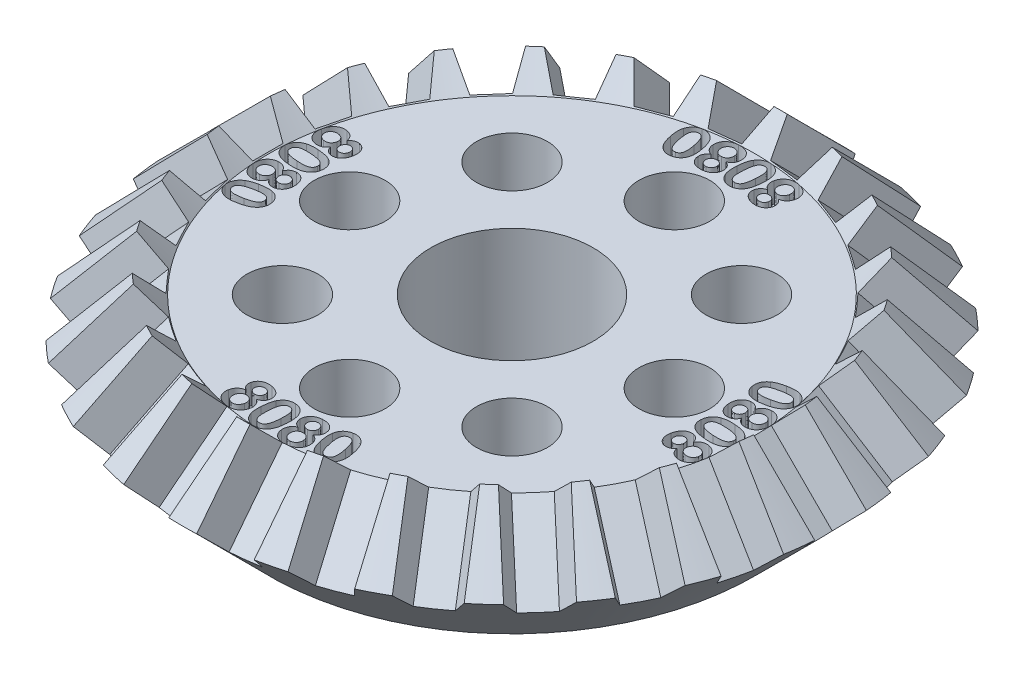
from build123d import *

# Parameters (mm, degrees)
CUT_EXTRUDE3_DEPTH  = 10
SKETCH5_3_R         = 1.75
CUT_EXTRUDE4_DEPTH  = 10
CIRPATTERN3_COUNT   = 8
CUT_EXTRUDE10_DEPTH = 1
CIRPATTERN10_COUNT  = 4
CUT_EXTRUDE11_DEPTH = 10
CIRPATTERN12_COUNT  = 26


with BuildPart() as part:
    # Sketch2 → Revolve4 (revolve)
    with BuildSketch(Plane.XY):
        Polygon((0, 0), (0, 6), (-12, 6), (-13.242640687, 7.242640687), (-16.242640687, 4.242640687), (-12, 0), align=None)
    revolve(axis=Axis((0, 0, 0), (0, 1, 0)))

    # Sketch5 → Cut-Extrude3 (cut)
    with BuildSketch(Plane(origin=(0, 6, 0), x_dir=(1, 0, 0), z_dir=(0, 1, 0))):
        with BuildLine():
            ThreePointArc((4, 0), (-2.828427125, 2.828427125), (0, -4))
            ThreePointArc((0, -4), (2.828427125, -2.828427125), (4, 0))
        make_face()
    extrude(amount=-CUT_EXTRUDE3_DEPTH, mode=Mode.SUBTRACT)

    # Sketch5<3> → Cut-Extrude4 (cut)
    with BuildSketch(Plane(origin=(0, 6, 0), x_dir=(1, 0, 0), z_dir=(0, 1, 0))):
        with Locations((0, -8)):
            Circle(SKETCH5_3_R)
    cut_extrude4 = extrude(amount=-CUT_EXTRUDE4_DEPTH, mode=Mode.SUBTRACT)

    # CirPattern3: Cut-Extrude4 ×8 about axis
    cirpattern3_axis = Axis((0, 0, 0), (0, 1, 0))
    for i in range(1, CIRPATTERN3_COUNT):
        add(cut_extrude4.rotate(cirpattern3_axis, i * 360 / CIRPATTERN3_COUNT), mode=Mode.SUBTRACT)

    # Sketch6 → Cut-Extrude10 (cut)
    # profile 1 of 4: a face of its own
    with BuildSketch(Plane(origin=(0, 6, 0), x_dir=(1, 0, 0), z_dir=(0, 1, 0))):
        with BuildLine():
            add(Edge.make_bspline(
                [(2.856464237, -10.674186552), (2.86301114, -10.70746857), (2.875604707, -10.771489588), (2.889046277, -10.864866803), (2.898886419, -10.951467691), (2.903271988, -11.032326107), (2.902972141, -11.108731392), (2.895780004, -11.182167147), (2.882868034, -11.253378388), (2.869129086, -11.299163516), (2.862323612, -11.321842802)],
                knots=[0, 0, 0, 0, 1.242240845, 2.389564305, 3.454538346, 4.433669945, 5.35421174, 6.250210014, 7.133255941, 8, 8, 8, 8], degree=3))
            add(Edge.make_bspline(
                [(2.862323612, -11.321842802), (2.852227982, -11.350140095), (2.832451329, -11.405572567), (2.791158422, -11.482269275), (2.742074851, -11.5515719), (2.693825223, -11.602241125), (2.652240235, -11.639110293), (2.618865547, -11.663455668), (2.58452233, -11.686017633), (2.548346458, -11.705484239), (2.510782258, -11.722750724), (2.471606508, -11.737529259), (2.430980003, -11.750284603), (2.40300418, -11.75630473), (2.388886112, -11.759342802)],
                knots=[0, 0, 0, 0, 1.594196746, 3.122922871, 4.610547235, 6.093258345, 6.82857878, 7.560442241, 8.28570525, 9.010010991, 9.740500182, 10.480491013, 11.233176019, 12, 12, 12, 12], degree=3))
            add(Edge.make_bspline(
                [(2.388886112, -11.759342802), (2.372518462, -11.762344441), (2.340199736, -11.768271325), (2.291578196, -11.772426929), (2.243638006, -11.772932666), (2.196244232, -11.769259888), (2.149195606, -11.762323253), (2.102660441, -11.751388374), (2.05691574, -11.736351802), (2.011838411, -11.718153686), (1.968449662, -11.695763056), (1.926252796, -11.670723708), (1.885949503, -11.642196874), (1.847835702, -11.610023244), (1.811269161, -11.575205677), (1.776795523, -11.536996136), (1.743896015, -11.495729746), (1.723973038, -11.466127287), (1.713886112, -11.451139677)],
                knots=[0, 0, 0, 0, 1.009576416, 1.993458057, 2.957716521, 3.916680837, 4.875710288, 5.841910214, 6.814168283, 7.796047999, 8.789281496, 9.774685683, 10.772468341, 11.782384999, 12.799758202, 13.834874351, 14.903805263, 16, 16, 16, 16], degree=3))
            add(Edge.make_bspline(
                [(1.713886112, -11.451139677), (1.703876519, -11.434738932), (1.683517323, -11.401380335), (1.657058611, -11.347882221), (1.631297068, -11.291710561), (1.608548415, -11.23181124), (1.587375533, -11.168887907), (1.568431728, -11.102728286), (1.550683419, -11.03374743), (1.540785619, -10.986468446), (1.535761112, -10.962467802)],
                knots=[0, 0, 0, 0, 0.881426141, 1.792792955, 2.736956775, 3.716924484, 4.731750058, 5.783302333, 6.874718359, 8, 8, 8, 8], degree=3))
            add(Edge.make_bspline(
                [(1.535761112, -10.962467802), (1.529833855, -10.931512993), (1.518306003, -10.87130936), (1.504734655, -10.782688321), (1.494016287, -10.698439472), (1.486813052, -10.618317903), (1.483577055, -10.542574345), (1.484294983, -10.471514129), (1.488589948, -10.405045291), (1.495102735, -10.362693712), (1.498261112, -10.342155302)],
                knots=[0, 0, 0, 0, 1.210677909, 2.354632883, 3.443498732, 4.47287823, 5.444113867, 6.354554314, 7.20204066, 8, 8, 8, 8], degree=3))
            add(Edge.make_bspline(
                [(1.498261112, -10.342155302), (1.501668463, -10.32530158), (1.508351972, -10.292243056), (1.52231845, -10.244284278), (1.538510915, -10.198649815), (1.557746695, -10.155435906), (1.579739606, -10.114818001), (1.603892994, -10.076161547), (1.631404628, -10.04024486), (1.661417142, -10.006654332), (1.694094634, -9.975586836), (1.729063356, -9.947195226), (1.766523401, -9.921528423), (1.806444234, -9.898938237), (1.848762772, -9.879005517), (1.893350548, -9.861717406), (1.940461053, -9.84773395), (1.97282539, -9.840409629), (1.989276737, -9.836686552)],
                knots=[0, 0, 0, 0, 1.095393145, 2.14861028, 3.180159673, 4.179429104, 5.159600127, 6.121904536, 7.081198825, 8.039092342, 8.989951051, 9.951575424, 10.906769378, 11.880455666, 12.871560315, 13.885571198, 14.925199563, 16, 16, 16, 16], degree=3))
            add(Edge.make_bspline(
                [(1.989276737, -9.836686552), (2.011093793, -9.83273441), (2.053985867, -9.824964546), (2.118132204, -9.820976658), (2.180250222, -9.822335384), (2.240317655, -9.829800472), (2.298256191, -9.842923971), (2.353741241, -9.862460989), (2.407116435, -9.88687027), (2.457753618, -9.917860863), (2.5062284, -9.953848315), (2.552648516, -9.995258211), (2.596935615, -10.042107862), (2.623684675, -10.076806663), (2.637323612, -10.094499052)],
                knots=[0, 0, 0, 0, 1.07627022, 2.115934445, 3.115636893, 4.090826647, 5.051341732, 5.995514834, 6.94355721, 7.897069916, 8.873694526, 9.87277647, 10.915361214, 12, 12, 12, 12], degree=3))
            add(Edge.make_bspline(
                [(2.637323612, -10.094499052), (2.649082945, -10.111366213), (2.673319802, -10.146130684), (2.70499791, -10.203874704), (2.735546216, -10.267170623), (2.763965726, -10.336708286), (2.789904296, -10.412491239), (2.8146804, -10.494083888), (2.836670476, -10.58205895), (2.849741641, -10.642897063), (2.856464237, -10.674186552)],
                knots=[0, 0, 0, 0, 0.790088108, 1.628430171, 2.528594234, 3.491778536, 4.514595847, 5.607453769, 6.769495871, 8, 8, 8, 8], degree=3))
        make_face()
        with BuildLine():
            add(Edge.make_bspline(
                [(2.501386112, -10.719108427), (2.493741471, -10.68258246), (2.479180136, -10.613008641), (2.45375991, -10.514732641), (2.42708162, -10.427552327), (2.398839506, -10.351080786), (2.367922481, -10.285248563), (2.334760766, -10.228799344), (2.296936295, -10.183058506), (2.262536851, -10.152114927), (2.233486653, -10.132711844), (2.210464484, -10.121834913), (2.186525995, -10.11321938), (2.161461889, -10.106755105), (2.135189467, -10.103789658), (2.107871281, -10.103563114), (2.079342841, -10.105331131), (2.06008501, -10.108758135), (2.050214237, -10.110514677)],
                knots=[0, 0, 0, 0, 2.110143075, 4.01935186, 5.738222495, 7.264530551, 8.624887666, 9.847318779, 10.956058751, 11.96810595, 12.452141123, 12.926387654, 13.40388151, 13.889649879, 14.386509397, 14.894644834, 15.433440349, 16, 16, 16, 16], degree=3))
            add(Edge.make_bspline(
                [(2.050214237, -10.110514677), (2.036285663, -10.11374279), (2.009378681, -10.119978805), (1.972099497, -10.135937865), (1.939318432, -10.156407597), (1.910664997, -10.181330367), (1.886561885, -10.211102015), (1.867072637, -10.245487661), (1.851600554, -10.284210758), (1.841540419, -10.327714117), (1.834463021, -10.375791078), (1.831319358, -10.428954429), (1.830884121, -10.487376078), (1.834303348, -10.55097714), (1.840588964, -10.619771262), (1.850162139, -10.693742965), (1.862489797, -10.772999961), (1.873196111, -10.827346542), (1.878729862, -10.855436552)],
                knots=[0, 0, 0, 0, 0.802607413, 1.550463388, 2.267478245, 2.967856516, 3.675580349, 4.410168812, 5.182317508, 6.011494677, 6.914285185, 7.912074212, 9.002878865, 10.197584679, 11.491336072, 12.886053727, 14.390500749, 16, 16, 16, 16], degree=3))
            add(Edge.make_bspline(
                [(1.878729862, -10.855436552), (1.886661295, -10.892998096), (1.901757356, -10.964489763), (1.927539303, -11.065657266), (1.954547558, -11.155463407), (1.983214606, -11.234247141), (2.014432193, -11.302304928), (2.048514121, -11.360094659), (2.085886679, -11.408008323), (2.120419147, -11.440163421), (2.149842545, -11.460104066), (2.17265578, -11.471896344), (2.196529877, -11.48091573), (2.221332928, -11.487026983), (2.247065961, -11.491300262), (2.27392691, -11.491612324), (2.301838353, -11.490456215), (2.320424848, -11.486924701), (2.329901737, -11.485124052)],
                knots=[0, 0, 0, 0, 2.133037786, 4.059855108, 5.799337743, 7.342271595, 8.714766994, 9.954369444, 11.061747666, 12.08089731, 12.560505073, 13.032964781, 13.504648236, 13.974942341, 14.450769508, 14.950214464, 15.464734931, 16, 16, 16, 16], degree=3))
            add(Edge.make_bspline(
                [(2.329901737, -11.485124052), (2.339721768, -11.482837197), (2.358814218, -11.478391013), (2.38591969, -11.468755115), (2.411277601, -11.457777711), (2.433736242, -11.443264714), (2.455008625, -11.427880376), (2.473179569, -11.409150115), (2.489777607, -11.388912594), (2.508881389, -11.358275337), (2.527923473, -11.314429113), (2.543788357, -11.255345493), (2.552432559, -11.188664373), (2.55375336, -11.128330338), (2.551448386, -11.075986869), (2.548867891, -11.032981773), (2.54431369, -10.987301628), (2.539126452, -10.938785323), (2.531387387, -10.887808594), (2.522897561, -10.83399013), (2.51263933, -10.777512398), (2.50519819, -10.738893036), (2.501386112, -10.719108427)],
                knots=[0, 0, 0, 0, 0.690075242, 1.341668663, 1.968368604, 2.577233658, 3.169474207, 3.762318913, 4.358508892, 4.959814194, 6.229483668, 7.616447763, 9.137695519, 10.824022603, 11.743397326, 12.72649882, 13.774652417, 14.887665546, 16.068312166, 17.305903601, 18.619820697, 20, 20, 20, 20], degree=3))
        make_face(mode=Mode.SUBTRACT)
    # profile 2 of 4: a face of its own
    with BuildSketch(Plane(origin=(0, 6, 0), x_dir=(1, 0, 0), z_dir=(0, 1, 0))):
        with BuildLine():
            add(Edge.make_bspline(
                [(0.091015625, -10.5375), (0.090562136, -10.515995585), (0.089656226, -10.473037365), (0.098779814, -10.408955566), (0.117824615, -10.346521753), (0.144389199, -10.285616397), (0.18051955, -10.228072083), (0.225453106, -10.17509243), (0.279745939, -10.128272988), (0.341527469, -10.086289189), (0.411058414, -10.051242218), (0.487420864, -10.024271245), (0.570200558, -10.0056964), (0.627773305, -10.000389285), (0.657421875, -9.99765625)],
                knots=[0, 0, 0, 0, 0.885377428, 1.768671152, 2.653186392, 3.568480428, 4.498998694, 5.443018017, 6.420261347, 7.444178353, 8.514441937, 9.619293894, 10.773994056, 12, 12, 12, 12], degree=3))
            add(Edge.make_bspline(
                [(0.657421875, -9.99765625), (0.682417276, -9.996481536), (0.731117542, -9.994192759), (0.802069996, -9.997383133), (0.868770722, -10.00580227), (0.930926731, -10.020008798), (0.988906351, -10.038414183), (1.041919663, -10.062257448), (1.090776363, -10.089374996), (1.13445324, -10.121269913), (1.173844942, -10.156079256), (1.208175656, -10.1940219), (1.238000816, -10.234542219), (1.262016963, -10.278070511), (1.281594404, -10.323660296), (1.297002697, -10.370919428), (1.307175895, -10.42008646), (1.310455569, -10.453475682), (1.312109375, -10.4703125)],
                knots=[0, 0, 0, 0, 1.323619717, 2.578899647, 3.753217694, 4.876536483, 5.948622175, 6.966573872, 7.947736925, 8.90014609, 9.822571302, 10.725014941, 11.602950856, 12.479019021, 13.349405345, 14.225392214, 15.105137946, 16, 16, 16, 16], degree=3))
            add(Edge.make_bspline(
                [(1.312109375, -10.4703125), (1.312655067, -10.491678673), (1.31372408, -10.533535113), (1.306009466, -10.595266016), (1.288707399, -10.65362361), (1.26407168, -10.709104971), (1.231207918, -10.761248568), (1.188728291, -10.808126629), (1.139556802, -10.852363182), (1.101319548, -10.876334804), (1.081640625, -10.888671875)],
                knots=[0, 0, 0, 0, 1.015178715, 1.988740217, 2.942761119, 3.898728001, 4.867238565, 5.858352967, 6.8977946, 8, 8, 8, 8], degree=3))
            add(Edge.make_bspline(
                [(1.081640625, -10.888671875), (1.09958388, -10.895036435), (1.134604388, -10.90745838), (1.184287317, -10.93033866), (1.228856022, -10.958015778), (1.269498985, -10.98863175), (1.305981306, -11.022510439), (1.337588724, -11.060075832), (1.365901592, -11.099960917), (1.388627223, -11.143713681), (1.407962302, -11.189900589), (1.42288906, -11.239071492), (1.433020362, -11.29106263), (1.43625043, -11.326783287), (1.437890625, -11.344921875)],
                knots=[0, 0, 0, 0, 1.107312827, 2.161182956, 3.174501651, 4.153169377, 5.117812601, 6.063473442, 7.004847067, 7.957038124, 8.924858285, 9.914486592, 10.940997423, 12, 12, 12, 12], degree=3))
            add(Edge.make_bspline(
                [(1.437890625, -11.344921875), (1.438757936, -11.3717665), (1.440465484, -11.424617794), (1.430288812, -11.502604725), (1.410197676, -11.577357743), (1.38507078, -11.636640028), (1.360277758, -11.681763712), (1.339071032, -11.714098933), (1.315096424, -11.744375629), (1.289287485, -11.773616715), (1.260622246, -11.800986191), (1.229471027, -11.82659218), (1.195975639, -11.850670219), (1.160156078, -11.872743727), (1.122280387, -11.89314307), (1.082329059, -11.911131256), (1.040363486, -11.926660466), (0.99672225, -11.94036811), (0.951200906, -11.951714847), (0.903856092, -11.960672337), (0.854677946, -11.967257525), (0.821238109, -11.970063046), (0.804296875, -11.971484375)],
                knots=[0, 0, 0, 0, 1.605423181, 3.160732928, 4.686335019, 6.226418963, 7.000776911, 7.765942991, 8.537629648, 9.310378071, 10.098573263, 10.906817449, 11.722169023, 12.565603334, 13.423318424, 14.29532419, 15.185561533, 16.100029279, 17.031865636, 17.991730252, 18.982573711, 20, 20, 20, 20], degree=3))
            add(Edge.make_bspline(
                [(0.804296875, -11.971484375), (0.786594227, -11.972420129), (0.751856334, -11.974256359), (0.70061143, -11.97433207), (0.65120139, -11.971530773), (0.603489274, -11.966446666), (0.557496285, -11.959291493), (0.513479786, -11.948879961), (0.471104895, -11.936550364), (0.430756134, -11.921250984), (0.392168272, -11.904100178), (0.356095068, -11.884623279), (0.322149415, -11.863373508), (0.290447374, -11.840254769), (0.260670622, -11.815340285), (0.233411064, -11.788284339), (0.208023336, -11.759674594), (0.178227818, -11.718488334), (0.145398473, -11.663722557), (0.116883797, -11.592271009), (0.096046519, -11.516675321), (0.090899345, -11.464194313), (0.08828125, -11.4375)],
                knots=[0, 0, 0, 0, 1.056687181, 2.073536468, 3.05308287, 4.005433391, 4.93317154, 5.825656735, 6.699999817, 7.562164195, 8.396014702, 9.215617158, 10.003854028, 10.781703213, 11.552940231, 12.315890682, 13.069464797, 13.830200813, 15.343831432, 16.861675642, 18.4037004, 20, 20, 20, 20], degree=3))
            add(Edge.make_bspline(
                [(0.08828125, -11.4375), (0.087555319, -11.423180123), (0.086130037, -11.395064685), (0.087525137, -11.353576218), (0.090877492, -11.313498465), (0.097057228, -11.274953546), (0.1060935, -11.23799446), (0.117773213, -11.202680405), (0.132478021, -11.169004482), (0.149019554, -11.136509417), (0.168769129, -11.105857895), (0.191262508, -11.076861345), (0.216066984, -11.049021094), (0.244207338, -11.023399415), (0.274090561, -10.998486872), (0.307343295, -10.976024338), (0.342670001, -10.954245779), (0.367985715, -10.941850286), (0.380859375, -10.935546875)],
                knots=[0, 0, 0, 0, 1.104846412, 2.169239406, 3.197034392, 4.20363341, 5.174984358, 6.127218024, 7.066937521, 8.00520853, 8.935174661, 9.872747451, 10.832201301, 11.805210376, 12.803820586, 13.828424798, 14.895700858, 16, 16, 16, 16], degree=3))
            add(Edge.make_bspline(
                [(0.380859375, -10.935546875), (0.359337954, -10.925687558), (0.317533137, -10.906536085), (0.261328666, -10.869307169), (0.21263401, -10.827341969), (0.171815778, -10.779907492), (0.138884953, -10.727016257), (0.114946534, -10.668408257), (0.097466067, -10.604937978), (0.093206068, -10.560400614), (0.091015625, -10.5375)],
                knots=[0, 0, 0, 0, 1.088100052, 2.113606884, 3.090567581, 4.038252801, 4.98282562, 5.944410651, 6.943038984, 8, 8, 8, 8], degree=3))
        make_face()
        with BuildLine():
            add(Edge.make_bspline(
                [(1.087109375, -11.3578125), (1.08555354, -11.341477375), (1.082523004, -11.309658975), (1.071470032, -11.264078273), (1.055303666, -11.222052565), (1.034247545, -11.183829108), (1.008801033, -11.149458129), (0.978787324, -11.119955254), (0.944772794, -11.094975833), (0.906886111, -11.075208338), (0.866069122, -11.06056772), (0.823314159, -11.050010476), (0.778325416, -11.045954335), (0.747917272, -11.04682298), (0.732421875, -11.047265625)],
                knots=[0, 0, 0, 0, 1.111946973, 2.165907724, 3.169714848, 4.157975736, 5.117155495, 6.060218951, 7.001792314, 7.96971562, 8.947661179, 9.93738128, 10.948929762, 12, 12, 12, 12], degree=3))
            add(Edge.make_bspline(
                [(0.732421875, -11.047265625), (0.72145822, -11.048237744), (0.699779517, -11.050159939), (0.668248609, -11.0564526), (0.638257115, -11.065418811), (0.610030053, -11.077404709), (0.582794581, -11.091269642), (0.557551016, -11.108568533), (0.533837121, -11.128406647), (0.511658498, -11.150447348), (0.491730105, -11.17496227), (0.47479417, -11.201703071), (0.461151067, -11.2305047), (0.450102664, -11.26107021), (0.442250479, -11.293822213), (0.437848706, -11.328517351), (0.435640044, -11.365223851), (0.436867431, -11.390234851), (0.4375, -11.403125)],
                knots=[0, 0, 0, 0, 1.014644763, 2.006281978, 2.959953283, 3.896761675, 4.831489039, 5.774206984, 6.712246399, 7.68040392, 8.653910418, 9.620203729, 10.592524108, 11.587863777, 12.613256297, 13.69185118, 14.810428164, 16, 16, 16, 16], degree=3))
            add(Edge.make_bspline(
                [(0.4375, -11.403125), (0.43900521, -11.419603222), (0.441940312, -11.451735133), (0.453740639, -11.49766455), (0.469584479, -11.54054002), (0.491172075, -11.57943293), (0.516923142, -11.614520237), (0.54701326, -11.644579415), (0.579904248, -11.671023296), (0.616990342, -11.691365473), (0.656182232, -11.70772386), (0.697878976, -11.717485155), (0.74097502, -11.723607454), (0.770293719, -11.722457796), (0.78515625, -11.721875)],
                knots=[0, 0, 0, 0, 1.125511206, 2.194704449, 3.219371301, 4.231678358, 5.214488266, 6.174129957, 7.121684634, 8.078863597, 9.04573379, 10.005211496, 10.988781613, 12, 12, 12, 12], degree=3))
            add(Edge.make_bspline(
                [(0.78515625, -11.721875), (0.800196842, -11.720318065), (0.829706935, -11.717263312), (0.872332692, -11.705946757), (0.912393755, -11.690107287), (0.949298554, -11.668684333), (0.983040391, -11.643194886), (1.012084578, -11.612526592), (1.037419765, -11.578304021), (1.05814316, -11.539933101), (1.073553032, -11.498052502), (1.084363195, -11.453531919), (1.08901931, -11.406333181), (1.087755276, -11.374221195), (1.087109375, -11.3578125)],
                knots=[0, 0, 0, 0, 1.025163234, 2.011401093, 2.983152565, 3.941422299, 4.899692033, 5.843708402, 6.798424513, 7.783274895, 8.793040319, 9.820031211, 10.886071978, 12, 12, 12, 12], degree=3))
        make_face(mode=Mode.SUBTRACT)
        with BuildLine():
            add(Edge.make_bspline(
                [(0.681640625, -10.247265625), (0.671581345, -10.248077851), (0.651838222, -10.249671987), (0.623325889, -10.255925035), (0.596069651, -10.263409296), (0.570833858, -10.2741613), (0.546927641, -10.286611568), (0.525080795, -10.302059539), (0.50463071, -10.319575484), (0.480396029, -10.346219974), (0.454455658, -10.383292941), (0.434273328, -10.434089976), (0.422611536, -10.48957661), (0.423669588, -10.528068424), (0.42421875, -10.548046875)],
                knots=[0, 0, 0, 0, 0.815821317, 1.601194102, 2.358270731, 3.100009384, 3.816617665, 4.535778502, 5.260477344, 5.991356284, 7.447023481, 8.893237821, 10.387493616, 12, 12, 12, 12], degree=3))
            add(Edge.make_bspline(
                [(0.42421875, -10.548046875), (0.426380318, -10.566416668), (0.430582601, -10.602129204), (0.448591702, -10.652602827), (0.476617671, -10.697197138), (0.513450838, -10.735454225), (0.557621106, -10.766093195), (0.607797544, -10.78694358), (0.662898017, -10.798425541), (0.700990886, -10.797403753), (0.720703125, -10.796875)],
                knots=[0, 0, 0, 0, 1.022121576, 1.987096651, 2.939674523, 3.91906958, 4.909371642, 5.895251516, 6.910837982, 8, 8, 8, 8], degree=3))
            add(Edge.make_bspline(
                [(0.720703125, -10.796875), (0.730894579, -10.796074171), (0.750772649, -10.794512181), (0.779520214, -10.788149538), (0.806943961, -10.780798482), (0.840514888, -10.766536383), (0.878728798, -10.744042068), (0.917208498, -10.708697836), (0.947539621, -10.666668307), (0.964598301, -10.626598135), (0.973910386, -10.592342699), (0.978700087, -10.565288235), (0.980133897, -10.536982107), (0.979322708, -10.517965891), (0.97890625, -10.508203125)],
                knots=[0, 0, 0, 0, 0.845290105, 1.648708541, 2.433540701, 3.192322416, 4.66215161, 6.08133375, 7.487434833, 8.921403278, 9.658902866, 10.424546004, 11.191175161, 12, 12, 12, 12], degree=3))
            add(Edge.make_bspline(
                [(0.97890625, -10.508203125), (0.977675267, -10.49526083), (0.975261724, -10.469885335), (0.966045446, -10.433267915), (0.952785196, -10.398932384), (0.935003088, -10.367342378), (0.914153806, -10.338253382), (0.889136439, -10.312968549), (0.860775461, -10.291458694), (0.82951647, -10.273311584), (0.795483557, -10.259887386), (0.759384919, -10.250098306), (0.721051764, -10.245926324), (0.69492481, -10.246814191), (0.681640625, -10.247265625)],
                knots=[0, 0, 0, 0, 1.05491296, 2.068330136, 3.056421155, 4.036609821, 5.005661574, 5.955645856, 6.914073567, 7.890258411, 8.882248801, 9.877786146, 10.920965635, 12, 12, 12, 12], degree=3))
        make_face(mode=Mode.SUBTRACT)
    # profile 3 of 4: a face of its own
    with BuildSketch(Plane(origin=(0, 6, 0), x_dir=(1, 0, 0), z_dir=(0, 1, 0))):
        with BuildLine():
            add(Edge.make_bspline(
                [(-0.055292362, -11.039811552), (-0.057715214, -11.074215899), (-0.062376945, -11.140412177), (-0.074127747, -11.235717947), (-0.087261139, -11.323419739), (-0.104055175, -11.404102917), (-0.12495582, -11.478921102), (-0.150098924, -11.549408974), (-0.180926343, -11.615894291), (-0.205828108, -11.657205725), (-0.218182987, -11.677702177)],
                knots=[0, 0, 0, 0, 1.24359613, 2.392762546, 3.462014738, 4.440998777, 5.362732067, 6.261390359, 7.137397951, 8, 8, 8, 8], degree=3))
            add(Edge.make_bspline(
                [(-0.218182987, -11.677702177), (-0.235428484, -11.702005731), (-0.269268118, -11.749694901), (-0.329437501, -11.81209352), (-0.395007172, -11.865565914), (-0.454890392, -11.901517911), (-0.505180762, -11.924949114), (-0.543561466, -11.940290797), (-0.583095794, -11.952308385), (-0.62306432, -11.962231596), (-0.664100893, -11.968857146), (-0.705865603, -11.972544228), (-0.748527736, -11.974500435), (-0.777169558, -11.972993656), (-0.791620487, -11.972233427)],
                knots=[0, 0, 0, 0, 1.582984985, 3.106180934, 4.593200904, 6.071731909, 6.805912463, 7.542733435, 8.267712544, 9.001664467, 9.731390239, 10.475560986, 11.230860376, 12, 12, 12, 12], degree=3))
            add(Edge.make_bspline(
                [(-0.791620487, -11.972233427), (-0.808189227, -11.970797375), (-0.841102552, -11.9679447), (-0.8894082, -11.95919709), (-0.936293365, -11.947279565), (-0.981157941, -11.930741873), (-1.025189505, -11.91249818), (-1.067107917, -11.889326932), (-1.107777252, -11.863373897), (-1.146421788, -11.833513594), (-1.182946762, -11.800855204), (-1.217196529, -11.765615182), (-1.248337943, -11.727490152), (-1.277478921, -11.687239403), (-1.30366657, -11.644103113), (-1.327019404, -11.598354223), (-1.347904428, -11.550068256), (-1.359539242, -11.516583978), (-1.365448612, -11.499577177)],
                knots=[0, 0, 0, 0, 1.007705959, 2.001778921, 2.972448205, 3.93616012, 4.897995282, 5.858696146, 6.835221081, 7.820385187, 8.815460491, 9.803529574, 10.796002961, 11.797102365, 12.813764792, 13.85165546, 14.908847002, 16, 16, 16, 16], degree=3))
            add(Edge.make_bspline(
                [(-1.365448612, -11.499577177), (-1.37044765, -11.480741356), (-1.38062888, -11.442379609), (-1.39270535, -11.38307925), (-1.401596851, -11.3209822), (-1.407814234, -11.256195727), (-1.411174131, -11.188677793), (-1.41228386, -11.118720725), (-1.411294018, -11.046268651), (-1.408353381, -10.997225367), (-1.406854862, -10.972233427)],
                knots=[0, 0, 0, 0, 0.879784648, 1.791802786, 2.730490244, 3.710942958, 4.729401934, 5.781907883, 6.869683615, 8, 8, 8, 8], degree=3))
            add(Edge.make_bspline(
                [(-1.406854862, -10.972233427), (-1.404418437, -10.94018787), (-1.399678543, -10.877845491), (-1.389959633, -10.786894145), (-1.377824612, -10.701196205), (-1.364037123, -10.6204406), (-1.34731653, -10.545221747), (-1.328186114, -10.475605873), (-1.307180658, -10.411546315), (-1.289835231, -10.371856626), (-1.281464237, -10.352702177)],
                knots=[0, 0, 0, 0, 1.214105754, 2.361957455, 3.454863437, 4.483567602, 5.456243376, 6.364424514, 7.210662786, 8, 8, 8, 8], degree=3))
            add(Edge.make_bspline(
                [(-1.281464237, -10.352702177), (-1.273707919, -10.33749671), (-1.258410498, -10.307507684), (-1.232592783, -10.264941934), (-1.20482249, -10.225383487), (-1.175143772, -10.188740996), (-1.14286923, -10.155720968), (-1.109330273, -10.124840366), (-1.073249937, -10.097575135), (-1.035273016, -10.073216908), (-0.995450772, -10.052280557), (-0.954137985, -10.034072897), (-0.911178322, -10.019235064), (-0.866615842, -10.007888775), (-0.820458268, -10.000254448), (-0.772874414, -9.995019987), (-0.723500952, -9.993397603), (-0.690182566, -9.995164298), (-0.673261112, -9.996061552)],
                knots=[0, 0, 0, 0, 1.087313565, 2.144457309, 3.16869824, 4.165110493, 5.1449449, 6.108166238, 7.067234196, 8.022310891, 8.979798717, 9.930831212, 10.896336421, 11.872229232, 12.856968448, 13.874839303, 14.920691774, 16, 16, 16, 16], degree=3))
            add(Edge.make_bspline(
                [(-0.673261112, -9.996061552), (-0.651072506, -9.998137688), (-0.607718712, -10.002194202), (-0.544663989, -10.014899269), (-0.485250407, -10.032749929), (-0.429282868, -10.056021367), (-0.376921013, -10.084116183), (-0.328067784, -10.117044893), (-0.283269456, -10.155304974), (-0.242190293, -10.198486908), (-0.204596304, -10.246400447), (-0.170427876, -10.298979913), (-0.140294595, -10.356621627), (-0.123584995, -10.397477953), (-0.115057987, -10.418327177)],
                knots=[0, 0, 0, 0, 1.077911837, 2.10610642, 3.106823242, 4.075788751, 5.034351033, 5.978135135, 6.921351078, 7.879602627, 8.857846599, 9.864596358, 10.910290938, 12, 12, 12, 12], degree=3))
            add(Edge.make_bspline(
                [(-0.115057987, -10.418327177), (-0.108059929, -10.437748815), (-0.093594969, -10.477893264), (-0.07824768, -10.542411415), (-0.065245428, -10.611995445), (-0.05590515, -10.687130217), (-0.05084567, -10.767733043), (-0.048297513, -10.853602297), (-0.050146899, -10.944947157), (-0.053541345, -11.0075289), (-0.055292362, -11.039811552)],
                knots=[0, 0, 0, 0, 0.787298717, 1.627343327, 2.526948887, 3.488476923, 4.514511237, 5.608160759, 6.766175108, 8, 8, 8, 8], degree=3))
        make_face()
        with BuildLine():
            add(Edge.make_bspline(
                [(-0.403729862, -10.990202177), (-0.402484595, -10.970805267), (-0.400053665, -10.932939877), (-0.39771866, -10.877328546), (-0.396532287, -10.824324228), (-0.396440116, -10.773916617), (-0.397789882, -10.7262608), (-0.39936657, -10.681286078), (-0.403199146, -10.638991226), (-0.408417105, -10.587181261), (-0.418823057, -10.528076317), (-0.436763963, -10.463814604), (-0.4612697, -10.408719666), (-0.486948798, -10.369163627), (-0.510703604, -10.342752306), (-0.52997786, -10.325321365), (-0.551243116, -10.310399297), (-0.574454655, -10.297856214), (-0.599611966, -10.287641576), (-0.62677286, -10.280031435), (-0.655576291, -10.273873723), (-0.675573727, -10.272269449), (-0.685761112, -10.271452177)],
                knots=[0, 0, 0, 0, 1.347224129, 2.629963582, 3.857706145, 5.02197285, 6.123395143, 7.162287872, 8.140401428, 9.066322185, 10.771248516, 12.29364159, 13.679227141, 14.935823134, 15.542939666, 16.137310484, 16.733255253, 17.339028606, 17.962494908, 18.610875038, 19.292331773, 20, 20, 20, 20], degree=3))
            add(Edge.make_bspline(
                [(-0.685761112, -10.271452177), (-0.70036023, -10.271029705), (-0.728508777, -10.270215139), (-0.769434689, -10.275916936), (-0.807397431, -10.286680176), (-0.842303215, -10.303750941), (-0.873868475, -10.326771077), (-0.902167681, -10.355447697), (-0.927896488, -10.389254191), (-0.94944676, -10.429366235), (-0.968985928, -10.474815948), (-0.986919834, -10.526097933), (-1.00264814, -10.583443448), (-1.01676459, -10.646661861), (-1.028613077, -10.715929895), (-1.039190512, -10.791208352), (-1.047652225, -10.872527231), (-1.051916573, -10.928732245), (-1.054120487, -10.957780302)],
                knots=[0, 0, 0, 0, 0.804633657, 1.55141345, 2.269836358, 2.973487496, 3.683382399, 4.414904861, 5.189370088, 6.019047464, 6.919945208, 7.91741533, 9.013804953, 10.199028576, 11.489992763, 12.890051375, 14.392706351, 16, 16, 16, 16], degree=3))
            add(Edge.make_bspline(
                [(-1.054120487, -10.957780302), (-1.055383266, -10.97769777), (-1.057858218, -11.016734513), (-1.059946377, -11.073916756), (-1.061906746, -11.128340909), (-1.06155586, -11.180047433), (-1.061176712, -11.229164537), (-1.058569228, -11.275515167), (-1.05559671, -11.319167735), (-1.05013837, -11.372376124), (-1.039841215, -11.433177116), (-1.021801596, -11.499137897), (-0.997841575, -11.556097837), (-0.972134439, -11.596658269), (-0.948720778, -11.624084088), (-0.929436655, -11.641782116), (-0.908264111, -11.657015286), (-0.885465115, -11.669929992), (-0.861082807, -11.680755164), (-0.834706501, -11.68817686), (-0.806850984, -11.694473896), (-0.787489213, -11.69603967), (-0.777557987, -11.696842802)],
                knots=[0, 0, 0, 0, 1.359986968, 2.665472411, 3.899394637, 5.07069201, 6.188889434, 7.246173117, 8.233682529, 9.170495203, 10.890437338, 12.429874823, 13.821057553, 15.086234431, 15.683926685, 16.274262244, 16.865330931, 17.457464368, 18.057523209, 18.677968164, 19.32189076, 20, 20, 20, 20], degree=3))
            add(Edge.make_bspline(
                [(-0.777557987, -11.696842802), (-0.767270845, -11.697304455), (-0.747198884, -11.69820522), (-0.717893141, -11.696163879), (-0.690040491, -11.691658769), (-0.664068636, -11.683502622), (-0.639008292, -11.674046169), (-0.615920257, -11.660885679), (-0.594256435, -11.645207207), (-0.567324965, -11.620086654), (-0.536526562, -11.582207787), (-0.505569021, -11.528060825), (-0.479035656, -11.464931347), (-0.461522316, -11.406056153), (-0.449365614, -11.354159772), (-0.440973029, -11.311238172), (-0.432604522, -11.26531669), (-0.425202315, -11.216349629), (-0.419125958, -11.164069278), (-0.41334757, -11.108851293), (-0.407605758, -11.050554453), (-0.405043328, -11.01065438), (-0.403729862, -10.990202177)],
                knots=[0, 0, 0, 0, 0.691779302, 1.349778805, 1.971490277, 2.583574748, 3.176905472, 3.768684325, 4.364013561, 4.97113264, 6.239934178, 7.628716957, 9.150586104, 10.834249415, 11.751530657, 12.733528869, 13.774101558, 14.889562165, 16.062224763, 17.312193944, 18.62226927, 20, 20, 20, 20], degree=3))
        make_face(mode=Mode.SUBTRACT)
    # profile 4 of 4: a face of its own
    with BuildSketch(Plane(origin=(0, 6, 0), x_dir=(1, 0, 0), z_dir=(0, 1, 0))):
        with BuildLine():
            add(Edge.make_bspline(
                [(-2.685152226, -10.189414569), (-2.680155506, -10.16916745), (-2.670205648, -10.128849802), (-2.644471239, -10.071712078), (-2.61095781, -10.018100753), (-2.56940304, -9.968457802), (-2.520316633, -9.923596667), (-2.462921783, -9.88653285), (-2.39895481, -9.856250095), (-2.328515412, -9.833352927), (-2.252594729, -9.818364079), (-2.172040964, -9.81386452), (-2.087722939, -9.817291808), (-2.031031481, -9.827524588), (-2.001949101, -9.832773944)],
                knots=[0, 0, 0, 0, 0.871624012, 1.73564591, 2.609925243, 3.511712334, 4.437997528, 5.382990385, 6.360794964, 7.393410267, 8.476424962, 9.590761808, 10.764075129, 12, 12, 12, 12], degree=3))
            add(Edge.make_bspline(
                [(-2.001949101, -9.832773944), (-1.97750721, -9.83813577), (-1.930128464, -9.848529262), (-1.862540807, -9.869731856), (-1.800579868, -9.895073067), (-1.744210843, -9.924437066), (-1.693261913, -9.956896517), (-1.647660518, -9.991970604), (-1.60788285, -10.03012003), (-1.573778353, -10.070803438), (-1.545365646, -10.1135754), (-1.521383427, -10.157378861), (-1.504035159, -10.202978106), (-1.491303053, -10.249403457), (-1.483912708, -10.29658594), (-1.48172137, -10.344349939), (-1.483725198, -10.392575498), (-1.489346706, -10.424484347), (-1.492183476, -10.440586444)],
                knots=[0, 0, 0, 0, 1.348453565, 2.613874664, 3.813106085, 4.952763529, 6.035397086, 7.065967044, 8.048918765, 9.000673855, 9.921513113, 10.813377793, 11.686736987, 12.544929923, 13.404671582, 14.255049625, 15.119449307, 16, 16, 16, 16], degree=3))
            add(Edge.make_bspline(
                [(-1.492183476, -10.440586444), (-1.496898671, -10.46057757), (-1.506187685, -10.499960417), (-1.530713765, -10.554893296), (-1.561626488, -10.605411679), (-1.600841327, -10.64991386), (-1.646459898, -10.689707725), (-1.699941087, -10.722243051), (-1.759921782, -10.749780834), (-1.803307682, -10.762252416), (-1.825777226, -10.768711444)],
                knots=[0, 0, 0, 0, 0.992402003, 1.955048323, 2.897862626, 3.849632644, 4.815061215, 5.817344054, 6.869603164, 8, 8, 8, 8], degree=3))
            add(Edge.make_bspline(
                [(-1.825777226, -10.768711444), (-1.809815642, -10.779631053), (-1.778599486, -10.800986594), (-1.736186156, -10.83707912), (-1.699210646, -10.875815167), (-1.667959559, -10.917226322), (-1.640984935, -10.960125122), (-1.620078065, -11.005447174), (-1.603222761, -11.05228248), (-1.592232738, -11.101237881), (-1.585247409, -11.151696238), (-1.584548681, -11.203782384), (-1.587612499, -11.257467833), (-1.594261599, -11.29337154), (-1.597652226, -11.311680194)],
                knots=[0, 0, 0, 0, 1.105053412, 2.161159013, 3.177396091, 4.160033802, 5.122703083, 6.06844416, 7.007835938, 7.963050841, 8.931630876, 9.914494131, 10.936521936, 12, 12, 12, 12], degree=3))
            add(Edge.make_bspline(
                [(-1.597652226, -11.311680194), (-1.603774193, -11.338353874), (-1.615797178, -11.390738544), (-1.647055967, -11.464424744), (-1.68537693, -11.533126039), (-1.725829693, -11.584500937), (-1.761800593, -11.62230572), (-1.791052608, -11.648276835), (-1.822013649, -11.672315456), (-1.854955709, -11.69381888), (-1.889807407, -11.713048358), (-1.926639643, -11.729647058), (-1.96510678, -11.744802415), (-2.005653616, -11.757031931), (-2.047576394, -11.767381628), (-2.090986771, -11.774194442), (-2.135304801, -11.778985902), (-2.180969722, -11.780890567), (-2.227791809, -11.780077625), (-2.275776224, -11.77652048), (-2.324942312, -11.770281329), (-2.357837105, -11.764066816), (-2.374605351, -11.760898944)],
                knots=[0, 0, 0, 0, 1.622906997, 3.187241106, 4.735794135, 6.284656248, 7.056058448, 7.833987435, 8.606048672, 9.382707507, 10.168595054, 10.968182088, 11.781237813, 12.622932006, 13.482214688, 14.344417036, 15.231115921, 16.129246605, 17.057614334, 18.011602718, 18.986406943, 20, 20, 20, 20], degree=3))
            add(Edge.make_bspline(
                [(-2.374605351, -11.760898944), (-2.391830676, -11.757151672), (-2.425819207, -11.74975766), (-2.47525268, -11.736125783), (-2.522318455, -11.720467837), (-2.566940382, -11.702910276), (-2.609201328, -11.683353116), (-2.649103007, -11.662004472), (-2.686396329, -11.638273742), (-2.721595177, -11.613129166), (-2.753890401, -11.58571769), (-2.783659761, -11.557052934), (-2.811136789, -11.52758427), (-2.835472398, -11.496336342), (-2.85741026, -11.464043835), (-2.876469436, -11.430223088), (-2.893618003, -11.395479944), (-2.911447005, -11.347080888), (-2.927941364, -11.284536914), (-2.937291376, -11.207029343), (-2.936331494, -11.12734907), (-2.927522399, -11.07449482), (-2.923042851, -11.047617694)],
                knots=[0, 0, 0, 0, 1.042727639, 2.057481098, 3.031843988, 3.975926965, 4.892682842, 5.78533566, 6.650854324, 7.506027771, 8.342399275, 9.154145028, 9.950056979, 10.723625334, 11.49488911, 12.257331962, 13.018723465, 13.784156682, 15.305009657, 16.833723396, 18.389904019, 20, 20, 20, 20], degree=3))
            add(Edge.make_bspline(
                [(-2.923042851, -11.047617694), (-2.919974338, -11.033379422), (-2.913928092, -11.005324098), (-2.901799229, -10.964714692), (-2.88727532, -10.926413745), (-2.870967985, -10.890250969), (-2.852056035, -10.856469429), (-2.831008133, -10.824878902), (-2.807916967, -10.795462889), (-2.782698717, -10.768294646), (-2.755363534, -10.743213129), (-2.725537394, -10.720496235), (-2.693464473, -10.700203693), (-2.65926757, -10.682302538), (-2.623136971, -10.665998565), (-2.584521225, -10.652555067), (-2.543785507, -10.641180337), (-2.515788996, -10.635347916), (-2.501558476, -10.632383319)],
                knots=[0, 0, 0, 0, 1.102536161, 2.172455328, 3.205207983, 4.202285652, 5.17328625, 6.133060449, 7.073860762, 8.001709011, 8.93680965, 9.879364708, 10.836654476, 11.80690401, 12.799927807, 13.835171574, 14.899625893, 16, 16, 16, 16], degree=3))
            add(Edge.make_bspline(
                [(-2.501558476, -10.632383319), (-2.520161276, -10.617571892), (-2.556072593, -10.588979537), (-2.602334174, -10.540405161), (-2.639734862, -10.488971578), (-2.667236103, -10.434120406), (-2.686009081, -10.376712991), (-2.69525288, -10.316487597), (-2.695955712, -10.253351038), (-2.688815489, -10.211094246), (-2.685152226, -10.189414569)],
                knots=[0, 0, 0, 0, 1.119369536, 2.160859352, 3.15006076, 4.104875564, 5.040033796, 5.984125014, 6.965763493, 8, 8, 8, 8], degree=3))
        make_face()
        with BuildLine():
            add(Edge.make_bspline(
                [(-1.945308476, -11.230820819), (-1.942433559, -11.214333404), (-1.936848217, -11.182301918), (-1.935319024, -11.134625329), (-1.939654682, -11.089237205), (-1.949228242, -11.046199049), (-1.964642193, -11.006007784), (-1.984961722, -10.969156531), (-2.010300002, -10.935647541), (-2.040993203, -10.906647359), (-2.075341166, -10.88103918), (-2.113551439, -10.860367415), (-2.15490873, -10.844116536), (-2.184008504, -10.837118242), (-2.198824101, -10.833555194)],
                knots=[0, 0, 0, 0, 1.134878421, 2.20482367, 3.225797407, 4.222734846, 5.18782571, 6.137209725, 7.070497099, 8.026807576, 8.993677261, 9.970552431, 10.966745317, 12, 12, 12, 12], degree=3))
            add(Edge.make_bspline(
                [(-2.198824101, -10.833555194), (-2.209472926, -10.831647008), (-2.230402723, -10.827896554), (-2.261828475, -10.826043768), (-2.29246272, -10.827110867), (-2.322260985, -10.831560264), (-2.351381564, -10.83848197), (-2.37974848, -10.84883648), (-2.407334346, -10.862077334), (-2.434103908, -10.878174952), (-2.459221535, -10.897032537), (-2.482304107, -10.918908076), (-2.502835743, -10.943524977), (-2.521505882, -10.970745926), (-2.537416951, -11.000963259), (-2.550976702, -11.033826577), (-2.562553209, -11.069315145), (-2.56792777, -11.094174335), (-2.570699101, -11.106992694)],
                knots=[0, 0, 0, 0, 0.999188164, 1.963860241, 2.903277925, 3.827462478, 4.74401454, 5.66529519, 6.612696302, 7.568317307, 8.547962603, 9.509928301, 10.500746384, 11.505499891, 12.555369756, 13.65054731, 14.788531397, 16, 16, 16, 16], degree=3))
            add(Edge.make_bspline(
                [(-2.570699101, -11.106992694), (-2.573593043, -11.123482593), (-2.579260395, -11.155775592), (-2.580485689, -11.203933466), (-2.577032472, -11.25022131), (-2.566538174, -11.293977866), (-2.551583885, -11.335059788), (-2.531210289, -11.372534308), (-2.507104272, -11.406911508), (-2.477941665, -11.436958969), (-2.445126644, -11.463024077), (-2.408430765, -11.483547571), (-2.36901781, -11.500046592), (-2.3411304, -11.50672274), (-2.326949101, -11.510117694)],
                knots=[0, 0, 0, 0, 1.140510093, 2.233518354, 3.276448428, 4.297633677, 5.292446665, 6.250090384, 7.198921053, 8.14741912, 9.09620822, 10.046907608, 11.006813853, 12, 12, 12, 12], degree=3))
            add(Edge.make_bspline(
                [(-2.326949101, -11.510117694), (-2.312277599, -11.512675182), (-2.283593708, -11.517675264), (-2.240338438, -11.517027115), (-2.198312486, -11.512511054), (-2.157867522, -11.500820221), (-2.119518421, -11.484009607), (-2.083507581, -11.462081534), (-2.051102682, -11.434212984), (-2.021082904, -11.402133657), (-1.995187513, -11.365135747), (-1.973393269, -11.323999254), (-1.956629665, -11.278872572), (-1.949134855, -11.247061536), (-1.945308476, -11.230820819)],
                knots=[0, 0, 0, 0, 1.00930133, 1.973260142, 2.926490062, 3.87280288, 4.819239662, 5.764187814, 6.724407186, 7.713158301, 8.741231261, 9.781668083, 10.867459077, 12, 12, 12, 12], degree=3))
        make_face(mode=Mode.SUBTRACT)
        with BuildLine():
            add(Edge.make_bspline(
                [(-2.044527226, -10.084336444), (-2.063608105, -10.081278007), (-2.100498699, -10.075364886), (-2.155340153, -10.078432937), (-2.206090733, -10.092436928), (-2.251982565, -10.116086276), (-2.292196467, -10.147907427), (-2.323744743, -10.188241347), (-2.348704097, -10.234716235), (-2.357020765, -10.269475685), (-2.361324101, -10.287461444)],
                knots=[0, 0, 0, 0, 1.095078291, 2.117202717, 3.091285679, 4.063542699, 5.031262166, 5.978192599, 6.95384594, 8, 8, 8, 8], degree=3))
            add(Edge.make_bspline(
                [(-2.361324101, -10.287461444), (-2.363938502, -10.304485855), (-2.369027078, -10.337621548), (-2.363231784, -10.387330889), (-2.348394406, -10.434502389), (-2.322543622, -10.47771061), (-2.288667447, -10.516141625), (-2.246648589, -10.547508389), (-2.197587285, -10.57136959), (-2.161544549, -10.580183532), (-2.142964726, -10.584727069)],
                knots=[0, 0, 0, 0, 0.998276039, 1.943008153, 2.882346369, 3.857021366, 4.84999199, 5.845647688, 6.889443744, 8, 8, 8, 8], degree=3))
            add(Edge.make_bspline(
                [(-2.142964726, -10.584727069), (-2.123748699, -10.587853231), (-2.086708306, -10.593879153), (-2.031865678, -10.589953095), (-1.981857445, -10.577105211), (-1.936697776, -10.555889409), (-1.897970332, -10.525789992), (-1.866363275, -10.487935502), (-1.841708233, -10.443194561), (-1.833248938, -10.409733272), (-1.828902226, -10.392539569)],
                knots=[0, 0, 0, 0, 1.129268934, 2.176754166, 3.170644664, 4.119258486, 5.058603976, 5.999322667, 6.971974735, 8, 8, 8, 8], degree=3))
            add(Edge.make_bspline(
                [(-1.828902226, -10.392539569), (-1.82686814, -10.380593792), (-1.822885532, -10.357204724), (-1.822802009, -10.322117539), (-1.826401111, -10.288000504), (-1.835634477, -10.255378857), (-1.848579086, -10.224276602), (-1.865282041, -10.195088464), (-1.886796677, -10.168771081), (-1.911893037, -10.144942233), (-1.940295909, -10.123722648), (-1.972206677, -10.106597144), (-2.007105638, -10.093000987), (-2.031806576, -10.087281766), (-2.044527226, -10.084336444)],
                knots=[0, 0, 0, 0, 1.033573869, 2.02367161, 2.986780606, 3.955590227, 4.907975427, 5.860035747, 6.817280913, 7.800795275, 8.81087576, 9.836276106, 10.885711371, 12, 12, 12, 12], degree=3))
        make_face(mode=Mode.SUBTRACT)
    cut_extrude10 = extrude(amount=-CUT_EXTRUDE10_DEPTH, mode=Mode.SUBTRACT)

    # CirPattern10: Cut-Extrude10 ×4 about axis
    cirpattern10_axis = Axis((0, 0, 0), (0, 1, 0))
    for i in range(1, CIRPATTERN10_COUNT):
        add(cut_extrude10.rotate(cirpattern10_axis, i * 360 / CIRPATTERN10_COUNT), mode=Mode.SUBTRACT)

    # Sketch4 → Cut-Extrude11 (cut)
    with BuildSketch(Plane(origin=(-6, -6, 0), x_dir=(0, 0, 1), z_dir=(-0.7071067811865476, -0.7071067811865475, 0))):
        Polygon((-0.747087507, 12.791051025), (0.747087507, 12.791051025), (1.411909827, 14.888208465), (-1.411909827, 14.888208465), align=None)
    cut_extrude11 = extrude(amount=-CUT_EXTRUDE11_DEPTH, mode=Mode.SUBTRACT)

    # CirPattern12: Cut-Extrude11 ×26 about axis
    cirpattern12_axis = Axis((0, 0, 0), (0, 1, 0))
    for i in range(1, CIRPATTERN12_COUNT):
        add(cut_extrude11.rotate(cirpattern12_axis, i * 360 / CIRPATTERN12_COUNT), mode=Mode.SUBTRACT)


solid = part.part
